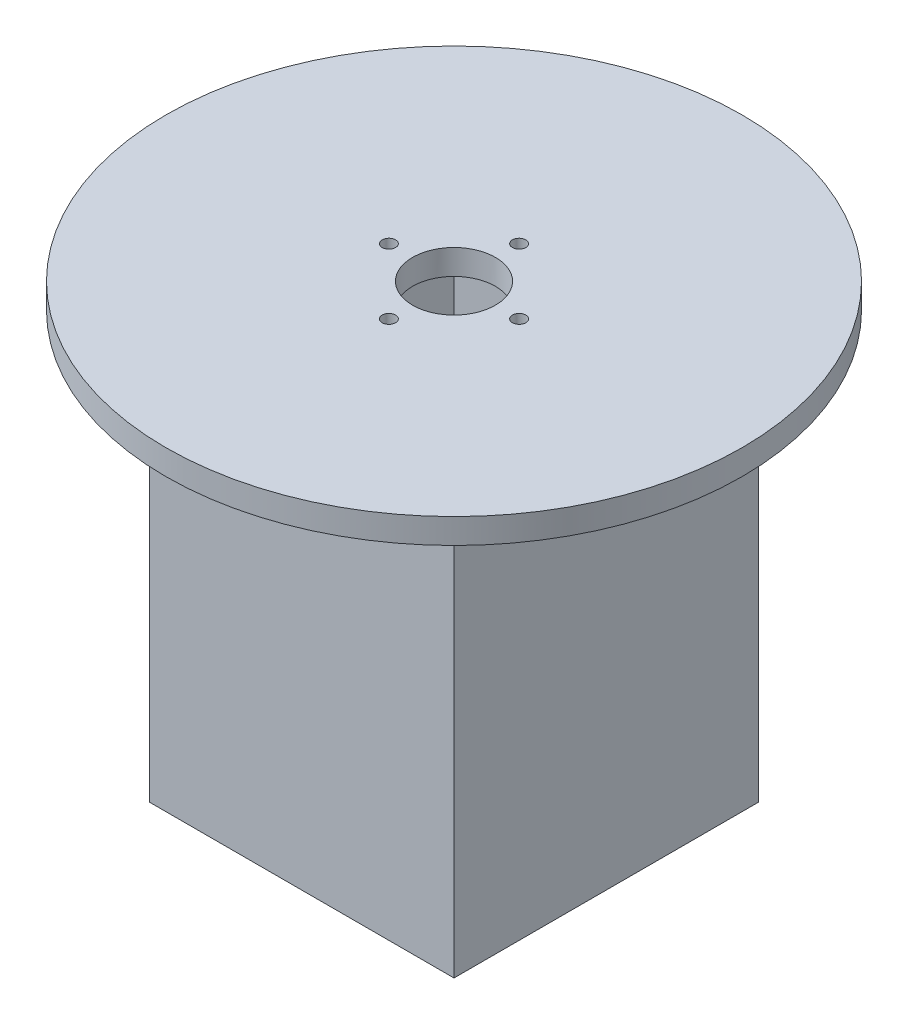
from build123d import *

# Parameters (mm, degrees)
SKETCH1_W           = 77.2
SKETCH1_H           = 114.3
BOSS_EXTRUDE1_DEPTH = 77.2
SKETCH2_W           = 70.58
SKETCH2_H           = 70.58
CUT_EXTRUDE1_DEPTH  = 107.95
SKETCH3_R           = 10.5
SKETCH3_R_2         = 1.7
CUT_EXTRUDE2_DEPTH  = 159.063816226
SKETCH4_R           = 73.025
SKETCH4_R_2         = 1.7
SKETCH4_R_3         = 10.5
BOSS_EXTRUDE4_DEPTH = 6.35


with BuildPart() as part:
    # Sketch1 → Boss-Extrude1 (new body)
    with BuildSketch(Plane.XY):
        with Locations((38.6, 57.15)):
            Rectangle(SKETCH1_W, SKETCH1_H)
    extrude(amount=-BOSS_EXTRUDE1_DEPTH)

    # Sketch2 → Cut-Extrude1 (cut)
    with BuildSketch(Plane.XZ):
        with Locations((38.6, -38.6)):
            Rectangle(SKETCH2_W, SKETCH2_H)
    extrude(amount=-CUT_EXTRUDE1_DEPTH, mode=Mode.SUBTRACT)

    # Sketch3 → Cut-Extrude2 (cut, through all)
    with BuildSketch(Plane(origin=(0, 114.3, 0), x_dir=(1, 0, 0), z_dir=(0, 1, 0))):
        with Locations((38.6, 38.6)):
            Circle(SKETCH3_R)
        with Locations((38.6, 55.1)):
            Circle(SKETCH3_R_2)
        with Locations((55.1, 38.6)):
            Circle(SKETCH3_R_2)
        with Locations((38.6, 22.1)):
            Circle(SKETCH3_R_2)
        with Locations((22.1, 38.6)):
            Circle(SKETCH3_R_2)
    extrude(amount=-CUT_EXTRUDE2_DEPTH, mode=Mode.SUBTRACT)

    # Sketch4 → Boss-Extrude4 (add)
    with BuildSketch(Plane(origin=(0, 114.3, 0), x_dir=(1, 0, 0), z_dir=(0, 1, 0))):
        with Locations((38.6, 38.6)):
            Circle(SKETCH4_R)
        with Locations((38.6, 55.1)):
            Circle(SKETCH4_R_2, mode=Mode.SUBTRACT)
        with Locations((55.1, 38.6)):
            Circle(SKETCH4_R_2, mode=Mode.SUBTRACT)
        with Locations((38.6, 22.1)):
            Circle(SKETCH4_R_2, mode=Mode.SUBTRACT)
        with Locations((22.1, 38.6)):
            Circle(SKETCH4_R_2, mode=Mode.SUBTRACT)
        with Locations((38.6, 38.6)):
            Circle(SKETCH4_R_3, mode=Mode.SUBTRACT)
    extrude(amount=-BOSS_EXTRUDE4_DEPTH)


solid = part.part
